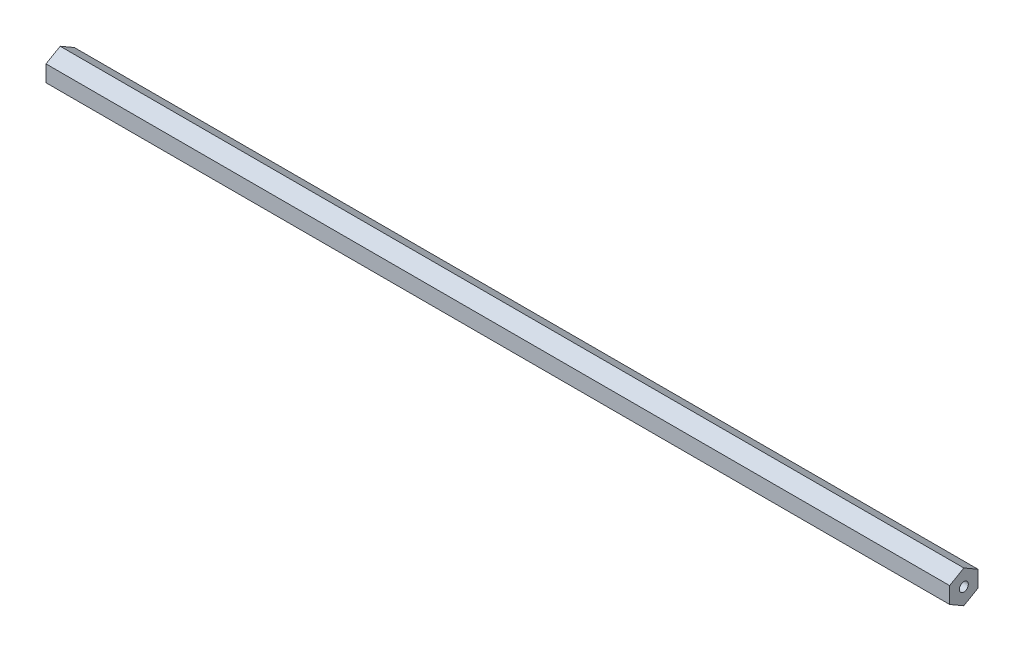
from build123d import *

# Parameters (mm, degrees)
BOSS_EXTRUDE1_DEPTH                  = 202.40625
F_10_32_TAPPED_HOLE1_D               = 4.0386
F_10_32_TAPPED_HOLE1_DEPTH           = 16.34744
F_10_32_TAPPED_HOLE1_TIP             = 1.213317848
F_10_32_TAPPED_HOLE1_ON_FACE_2_D     = 4.0386
F_10_32_TAPPED_HOLE1_ON_FACE_2_DEPTH = 16.34744
F_10_32_TAPPED_HOLE1_ON_FACE_2_TIP   = 1.213317848


with BuildPart() as part:
    # Sketch1 → Boss-Extrude1 (new, symmetric)
    with BuildSketch(Plane(origin=(0, 0, 0), x_dir=(0, 0, -1), z_dir=(1, 0, 0))):
        Polygon((6.35, 3.666174209), (0, 7.332348419), (-6.35, 3.666174209), (-6.35, -3.666174209), (0, -7.332348419), (6.35, -3.666174209), align=None)
    extrude(amount=BOSS_EXTRUDE1_DEPTH, both=True)

    # #10-32 Tapped Hole1
    with Locations(Plane(origin=(202.40625, 0, 0), x_dir=(0, 0, 1), z_dir=(1, 0, 0))):
        with Locations((0, 0)):
            Hole(F_10_32_TAPPED_HOLE1_D / 2, depth=F_10_32_TAPPED_HOLE1_DEPTH)
            with Locations((0, 0, -(F_10_32_TAPPED_HOLE1_DEPTH + F_10_32_TAPPED_HOLE1_TIP / 2))):  # 118° drill point
                Cone(0, F_10_32_TAPPED_HOLE1_D / 2, F_10_32_TAPPED_HOLE1_TIP, mode=Mode.SUBTRACT)

    # #10-32 Tapped Hole1 on face 2
    with Locations(Plane(origin=(-202.40625, 0, 0), x_dir=(0, 0, -1), z_dir=(-1, 0, 0))):
        with Locations((0, 0)):
            Hole(F_10_32_TAPPED_HOLE1_ON_FACE_2_D / 2, depth=F_10_32_TAPPED_HOLE1_ON_FACE_2_DEPTH)
            with Locations((0, 0, -(F_10_32_TAPPED_HOLE1_ON_FACE_2_DEPTH + F_10_32_TAPPED_HOLE1_ON_FACE_2_TIP / 2))):  # 118° drill point
                Cone(0, F_10_32_TAPPED_HOLE1_ON_FACE_2_D / 2, F_10_32_TAPPED_HOLE1_ON_FACE_2_TIP, mode=Mode.SUBTRACT)


solid = part.part
